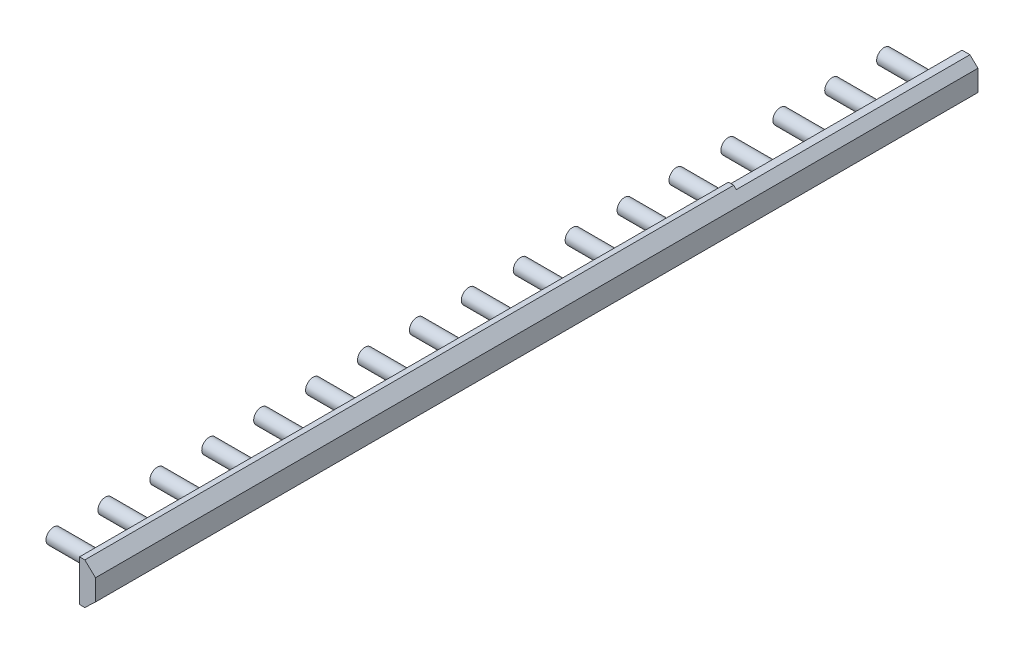
from build123d import *

# Parameters (mm, degrees)
BOSS_EXTRUDE1_DEPTH = 340
SKETCH2_R           = 2.9
BOSS_EXTRUDE2_DEPTH = 20
SKETCH4_R           = 2.9
BOSS_EXTRUDE3_DEPTH = 20
SKETCH8_W           = 90
SKETCH8_H           = 0.95
CUT_EXTRUDE2_DEPTH  = 5


with BuildPart() as part:
    # Sketch1 → Boss-Extrude1 (new body)
    with BuildSketch(Plane.XY):
        Polygon((0, 7.95), (2.04, 7.95), (6.152414984, 4.048), (6.152414984, -4.048), (2.04, -7.95), (0, -7.95), align=None)
    extrude(amount=BOSS_EXTRUDE1_DEPTH)

    # Sketch2 → Boss-Extrude2 (add)
    with BuildSketch(Plane.ZY):
        with Locations((10, 0)):
            Circle(SKETCH2_R)
        with Locations((30, 0)):
            Circle(SKETCH2_R)
        with Locations((50, 0)):
            Circle(SKETCH2_R)
        with Locations((70, 0)):
            Circle(SKETCH2_R)
        with Locations((90, 0)):
            Circle(SKETCH2_R)
        with Locations((110, 0)):
            Circle(SKETCH2_R)
        with Locations((130, 0)):
            Circle(SKETCH2_R)
        with Locations((150, 0)):
            Circle(SKETCH2_R)
        with Locations((170, 0)):
            Circle(SKETCH2_R)
        with Locations((190, 0)):
            Circle(SKETCH2_R)
        with Locations((210, 0)):
            Circle(SKETCH2_R)
        with Locations((230, 0)):
            Circle(SKETCH2_R)
        with Locations((250, 0)):
            Circle(SKETCH2_R)
    extrude(amount=BOSS_EXTRUDE2_DEPTH)

    # Sketch4 → Boss-Extrude3 (add)
    with BuildSketch(Plane.ZY):
        with Locations((270, 0)):
            Circle(SKETCH4_R)
        with Locations((290, 0)):
            Circle(SKETCH4_R)
        with Locations((310, 0)):
            Circle(SKETCH4_R)
        with Locations((330, 0)):
            Circle(SKETCH4_R)
    extrude(amount=BOSS_EXTRUDE3_DEPTH)

    # Sketch8 → Cut-Extrude2 (cut)
    with BuildSketch(Plane.ZY):
        with Locations((45, 7.475)):
            Rectangle(SKETCH8_W, SKETCH8_H)
    extrude(amount=-CUT_EXTRUDE2_DEPTH, mode=Mode.SUBTRACT)


solid = part.part
